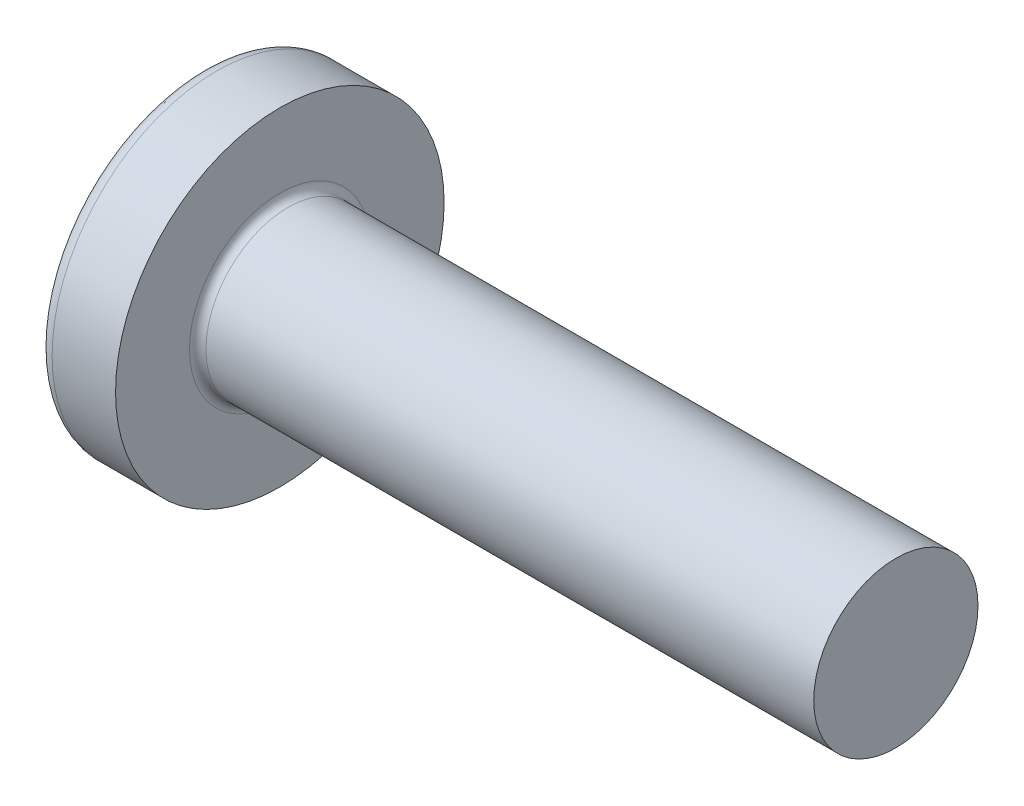
from build123d import *

# Parameters (mm, degrees)
RECPAT_COUNT       = 2
RECPAT_ANGLE       = 90
BOSS_EXTRU_1_START = 10
ESQUISSE1_R        = 2
BOSS_EXTRU_1_DEPTH = 10


with BuildPart() as part:
    # Fillet1: read off the stored shape, not the designer's step
    # Fillet1 outline → Fillet1 (revolve)
    with BuildSketch(Plane.YX):
        with BuildLine():
            Line((2, 3.3), (2, 8.1))
            Line((2, 8.1), (0, 8.1))
            Line((0, 8.1), (0, 0))
            ThreePointArc((0, 0), (2.027933458, 0.324444488), (3.853420198, 1.265388956))
            ThreePointArc((3.853420198, 1.265388956), (3.961271902, 1.392873227), (4, 1.555305874))
            Line((4, 1.555305874), (4, 3.1))
            Line((4, 3.1), (2.2, 3.1))
            ThreePointArc((2.2, 3.1), (2.058578644, 3.158578644), (2, 3.3))
        make_face()
    revolve(axis=Axis((0, 0, 0), (1, 0, 0)))

    # Sketch3 → Recess section 0
    with BuildSketch(Plane(origin=(0, 0, 0), x_dir=(0, 0, -1), z_dir=(1, 0, 0))):
        with BuildLine():
            Line((0.515, -2.15), (-0.515, -2.15))
            Line((-0.515, -2.15), (-0.515, 2.15))
            Line((-0.515, 2.15), (0.515, 2.15))
            Line((0.515, 2.15), (0.515, -2.15))
        make_face()
    # Sketch4 → Recess section 1
    with BuildSketch(Plane(origin=(2.34, 0, 0), x_dir=(0, 0, -1), z_dir=(1, 0, 0))):
        with BuildLine():
            Line((0.515, -0.983319232), (-0.515, -0.983319232))
            Line((-0.515, -0.983319232), (-0.515, 0.983319232))
            Line((-0.515, 0.983319232), (0.515, 0.983319232))
            Line((0.515, 0.983319232), (0.515, -0.983319232))
        make_face()
    recess = loft(mode=Mode.SUBTRACT)

    # RecPat: Recess ×2 about axis
    recpat_axis = Axis((0, 0, 0), (1, 0, 0))
    for i in range(1, RECPAT_COUNT):
        add(recess.rotate(recpat_axis, i * RECPAT_ANGLE / (RECPAT_COUNT - 1)), mode=Mode.SUBTRACT)

    # RecCorSke → RecessCore (revolve, cut)
    with BuildSketch(Plane.XY, mode=Mode.PRIVATE) as recesscore_sk:
        Polygon((0, 0), (0, 1.01462874), (2.34, 0.851), (2.616506661, 0), align=None)
    revolve(recesscore_sk.sketch.rotate(Axis((-3.175, 0, 0), (1, 0, 0)), 90), axis=Axis((-3.175, 0, 0), (1, 0, 0)), mode=Mode.SUBTRACT)

    # Esquisse1 → Boss.-Extru.1 (add)
    with BuildSketch(Plane(origin=(8.1, 0, 0), x_dir=(0, 0, -1), z_dir=(1, 0, 0)).offset(BOSS_EXTRU_1_START)):
        with Locations(Location((0, 0, 0), (0, 0, 180))):
            Circle(ESQUISSE1_R)
    extrude(amount=-BOSS_EXTRU_1_DEPTH)


solid = part.part
